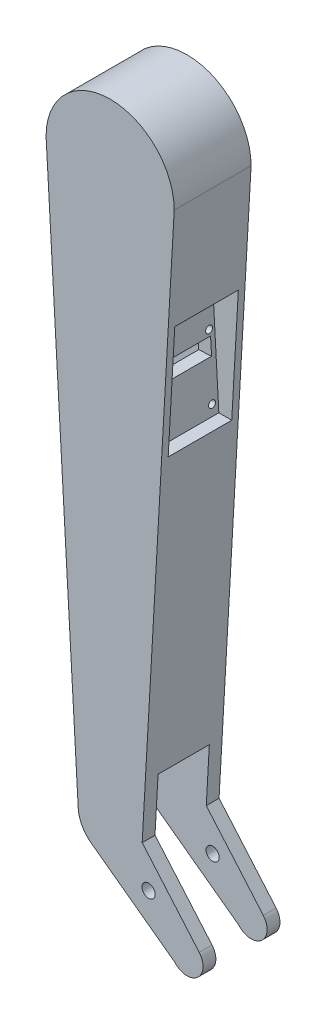
from build123d import *

# Parameters (mm, degrees)
ESQUISSE1_R                  = 2.575
BOSS_EXTRU_1_DEPTH           = 15
ENL_V_MAT_EXTRU_1_DEPTH      = 152.420358605
ENL_V_MAT_EXTRU_1_DEPTH_BACK = 152.420358605
ESQUISSE2_W                  = 24.8
ESQUISSE2_H                  = 45.3
ESQUISSE2_W_2                = 20
ESQUISSE2_H_2                = 80
ESQUISSE3_W                  = 24.8
ESQUISSE3_H                  = 55.373062207
ESQUISSE3_R                  = 1.35
ESQUISSE3_W_2                = 21.500268749
ESQUISSE3_H_2                = 6.675
BOSS_EXTRU_2_DEPTH           = 5
CHANFREIN1_SIZE              = 20
CHANFREIN1_SIZE2             = 21.239019518


with BuildPart() as part:
    # Esquisse1 → Boss.-Extru.1 (new, symmetric)
    with BuildSketch(Plane.XY):
        with BuildLine():
            ThreePointArc((25, 110), (0, 135), (-25, 110))
            Line((-25, 110), (-12.5, -110))
            ThreePointArc((-12.5, -110), (-11.152775163, -115.644962902), (-7.401503013, -120.073120328))
            Line((-7.401503013, -120.073120328), (25.25622395, -144.069286029))
            ThreePointArc((25.25622395, -144.069286029), (34.069286029, -144.74377605), (34.74377605, -135.930713971))
            Line((34.74377605, -135.930713971), (12.5, -110))
            Line((12.5, -110), (25, 110))
        make_face()
        with Locations((15, -125)):
            Circle(ESQUISSE1_R, mode=Mode.SUBTRACT)
    extrude(amount=BOSS_EXTRU_1_DEPTH, both=True)

    # Esquisse2 → Enlèv. mat.-Extru.1 (cut, two sides: drawn at the far end of the back side and taken through both)
    with BuildSketch(Plane(origin=(0, 0, 0), x_dir=(0, 0, -1), z_dir=(1, 0, 0)).offset(-ENL_V_MAT_EXTRU_1_DEPTH_BACK)):
        with Locations((0, 45.459643015)):
            Rectangle(ESQUISSE2_W, ESQUISSE2_H)
        with Locations((0, -150)):
            Rectangle(ESQUISSE2_W_2, ESQUISSE2_H_2)
    extrude(amount=ENL_V_MAT_EXTRU_1_DEPTH + ENL_V_MAT_EXTRU_1_DEPTH_BACK, mode=Mode.SUBTRACT)

    # Esquisse3 → Boss.-Extru.2 (add)
    with BuildSketch(Plane(origin=(11.262028296, 0.639887971, 0), x_dir=(0, 0, 1), z_dir=(-0.9983897448572466, -0.05672669004870742, 0))):
        with Locations((0, 46.596588141)):
            Rectangle(ESQUISSE3_W, ESQUISSE3_H)
        with Locations((-9.961703908, 25.955511582)):
            Circle(ESQUISSE3_R, mode=Mode.SUBTRACT)
        with Locations((10.038296092, 25.955511582)):
            Circle(ESQUISSE3_R, mode=Mode.SUBTRACT)
        with Locations((0.088430467, 44.718011582)):
            Rectangle(ESQUISSE3_W_2, ESQUISSE3_H_2, mode=Mode.SUBTRACT)
        with Locations((-10.211703908, 50.405511582)):
            Circle(ESQUISSE3_R, mode=Mode.SUBTRACT)
        with Locations((10.288296092, 50.405511582)):
            Circle(ESQUISSE3_R, mode=Mode.SUBTRACT)
    extrude(amount=-BOSS_EXTRU_2_DEPTH)

    # Chanfrein1
    chanfrein1_edges = [part.edges().sort_by_distance(p)[0] for p in [
        (12.5, -110, 0),
    ]]
    chanfrein1_side = [part.faces().sort_by_distance(p)[0] for p in [
        (0, -110, 0),
    ]]
    chamfer(chanfrein1_edges, length=CHANFREIN1_SIZE, length2=CHANFREIN1_SIZE2, reference=chanfrein1_side[0])


solid = part.part
